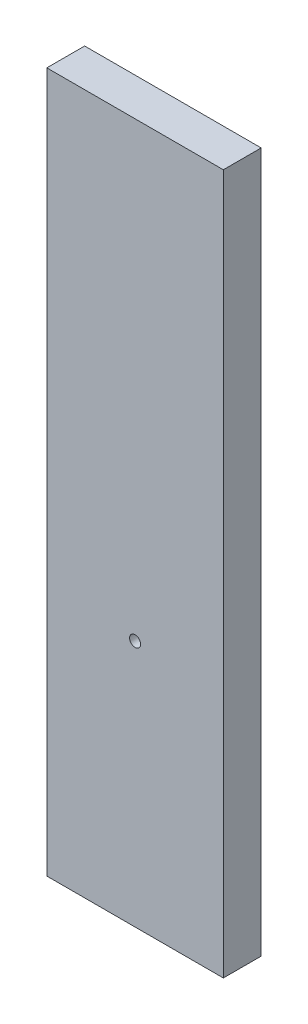
from build123d import *

# Parameters (mm, degrees)
SKETCH1_W           = 88.9
SKETCH1_H           = 19.05
BOSS_EXTRUDE1_DEPTH = 352.522028
SKETCH2_R           = 2.778125
CUT_EXTRUDE1_DEPTH  = 365.057540404


with BuildPart() as part:
    # Sketch1 → Boss-Extrude1 (new body)
    with BuildSketch(Plane(origin=(0, 0, 0), x_dir=(1, 0, 0), z_dir=(0, 1, 0))):
        with Locations((44.45, 9.525)):
            Rectangle(SKETCH1_W, SKETCH1_H)
    extrude(amount=BOSS_EXTRUDE1_DEPTH)

    # Sketch2 → Cut-Extrude1 (cut, through all)
    with BuildSketch(Plane.XY):
        with Locations((44.45, 124.723380373)):
            Circle(SKETCH2_R)
    extrude(amount=-CUT_EXTRUDE1_DEPTH, mode=Mode.SUBTRACT)


solid = part.part
